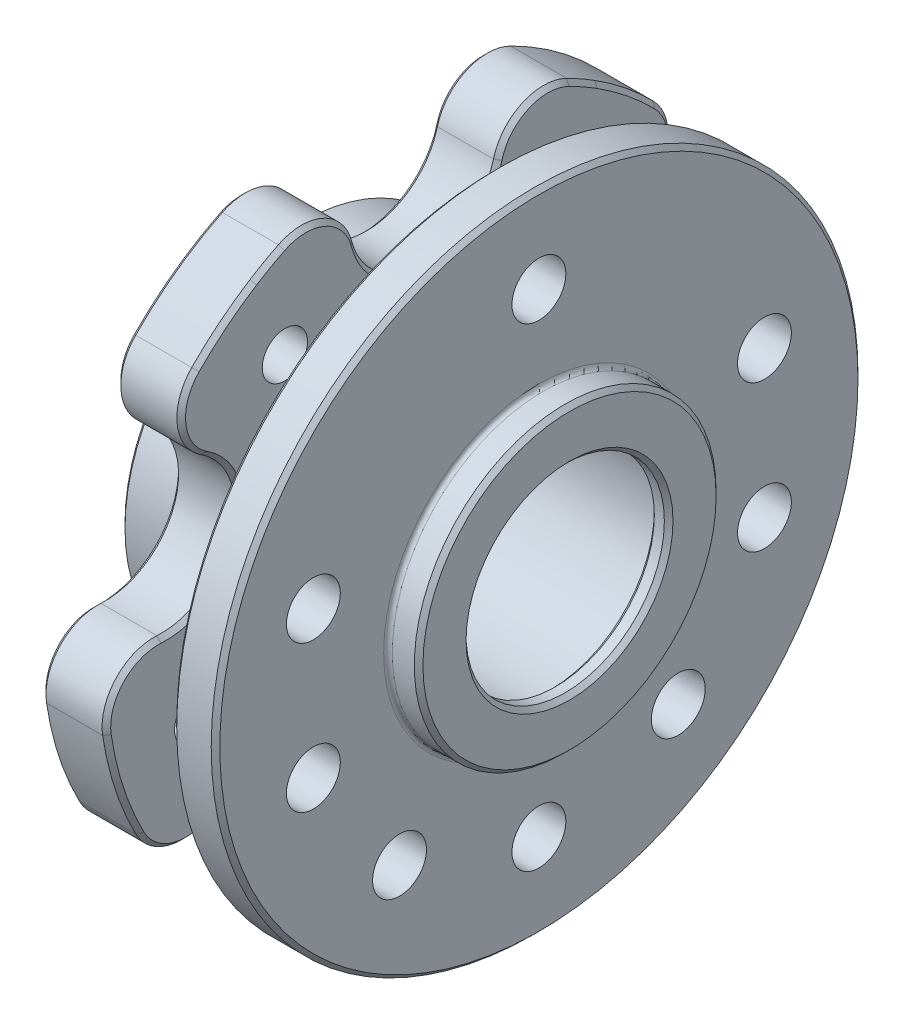
from build123d import *

# Parameters (mm, degrees)
DODANIE_WYCI_GNI_CIE1_START      = -36.1
SZKIC6_R                         = 25
SZKIC6_R_2                       = 15
DODANIE_WYCI_GNI_CIE1_DEPTH      = 36.1
WYTNIJ_WYCI_GNI_CIE4_REACH       = 132.542
SZKIC7_R                         = 15.25
SZKIC7_R_2                       = 15
SZKIC12_R                        = 31
SZKIC12_R_2                      = 15.25
WYTNIJ_WYCI_GNI_CIE9_DEPTH       = 10
WYTNIJ_WYCI_GNI_CIE10_START      = -2
SZKIC13_R                        = 29
SZKIC13_R_2                      = 15.25
WYTNIJ_WYCI_GNI_CIE10_DEPTH      = 2
SZKIC14_R                        = 31
SZKIC14_R_2                      = 26
DODANIE_WYCI_GNI_CIE3_DEPTH      = 52
SZKIC15_R                        = 26
WYTNIJ_WYCI_GNI_CIE11_DEPTH      = 7
SZKIC22_R                        = 27.5
WYTNIJ_WYCI_GNI_CIE18_DEPTH      = 2
SFAZOWANIE1_SIZE                 = 2
SZKIC25_R                        = 75
SZKIC25_R_2                      = 41
WYTNIJ_WYCI_GNI_CIE19_DEPTH      = 5
SZKIC26_R                        = 75
SZKIC26_R_2                      = 41
DODANIE_WYCI_GNI_CIE4_DEPTH      = 5
WYTNIJ_WYCI_GNI_CIE20_START      = -15
WYTNIJ_WYCI_GNI_CIE20_DEPTH      = 15
ZAOKR_GLENIE1_R                  = 12
OTW_R_GWINTOWANY_M12X1_51_REACH  = 124.406
OTW_R_GWINTOWANY_M12X1_51_BORE_R = 5.25
OTW_R_GWINTOWANY_M14X1_51_REACH  = 121.942
OTW_R_GWINTOWANY_M14X1_51_BORE_R = 6.25
ZAOKR_GLENIE2_R                  = 1
SFAZOWANIE2_SIZE                 = 1
SFAZOWANIE3_SIZE                 = 1
DODANIE_WYCI_GNI_CIE5_START      = -2.32
SZKIC34_R                        = 26
SZKIC34_R_2                      = 23
DODANIE_WYCI_GNI_CIE5_DEPTH      = 2.32
SZKIC35_R                        = 35
SZKIC35_R_2                      = 15.25
WYTNIJ_WYCI_GNI_CIE28_DEPTH      = 10
SZKIC37_R                        = 26
WYTNIJ_WYCI_GNI_CIE30_DEPTH      = 4.78
SZKIC38_R                        = 23
WYTNIJ_WYCI_GNI_CIE31_DEPTH      = 2.32
SZKIC39_R                        = 35
WYTNIJ_WYCI_GNI_CIE32_DEPTH      = 5
DODANIE_WYCI_GNI_CIE6_START      = -2.32
SZKIC40_R                        = 26
SZKIC40_R_2                      = 23
DODANIE_WYCI_GNI_CIE6_DEPTH      = 2.32
SZKIC41_R                        = 35
SZKIC41_R_2                      = 23
DODANIE_WYCI_GNI_CIE7_DEPTH      = 2
SFAZOWANIE7_SIZE                 = 1
SFAZOWANIE8_SIZE                 = 1


with BuildPart() as part:
    # Szkic1 → Obrót1 (revolve)
    with BuildSketch(Plane.XY, mode=Mode.PRIVATE) as obr_t1_sk:
        Polygon((-76.1, 31), (-76.1, 41), (-56.1, 41), (-56.1, 75), (-41.1, 75), (-41.1, 41), (-30.1, 41), (-30.1, 75), (-20.1, 75), (-20.1, 35), (0, 35), (0, 25), (-36.1, 25), (-36.1, 31), (-64.1, 31), align=None)
    revolve(obr_t1_sk.sketch.rotate(Axis((-107.268186934, 0, 0), (1, 0, 0)), 90), axis=Axis((-107.268186934, 0, 0), (1, 0, 0)))

    # Szkic6 → Dodanie-wyciągnięcie1 (add)
    with BuildSketch(Plane(origin=(0, 0, 0), x_dir=(0, 0, -1), z_dir=(1, 0, 0)).offset(DODANIE_WYCI_GNI_CIE1_START)):
        Circle(SZKIC6_R)
        Circle(SZKIC6_R_2, mode=Mode.SUBTRACT)
    extrude(amount=DODANIE_WYCI_GNI_CIE1_DEPTH)

    # Szkic7 → Wytnij-wyciągnięcie4 (cut, up to next)
    with BuildSketch(Plane(origin=(0, 0, 0), x_dir=(0, 0, -1), z_dir=(1, 0, 0)), mode=Mode.PRIVATE) as wytnij_wyci_gni_cie4_sk1:
        Circle(SZKIC7_R)
        Circle(SZKIC7_R_2, mode=Mode.SUBTRACT)
    wytnij_wyci_gni_cie4_tool1 = extrude(wytnij_wyci_gni_cie4_sk1.sketch, amount=-WYTNIJ_WYCI_GNI_CIE4_REACH, mode=Mode.PRIVATE) & part.part
    add(wytnij_wyci_gni_cie4_tool1.solids().sort_by_distance((0, 0, 15.206866))[0], mode=Mode.SUBTRACT)

    # Szkic12 → Wytnij-wyciągnięcie9 (cut)
    with BuildSketch(Plane.ZY.offset(36.1)):
        Circle(SZKIC12_R)
        with Locations(Location((0, 0, 0), (0, 0, 180))):
            Circle(SZKIC12_R_2, mode=Mode.SUBTRACT)
    extrude(amount=-WYTNIJ_WYCI_GNI_CIE9_DEPTH, mode=Mode.SUBTRACT)

    # Szkic13 → Wytnij-wyciągnięcie10 (cut)
    with BuildSketch(Plane.ZY.offset(26.1).offset(WYTNIJ_WYCI_GNI_CIE10_START)):
        Circle(SZKIC13_R)
        with Locations(Location((0, 0, 0), (0, 0, 180))):
            Circle(SZKIC13_R_2, mode=Mode.SUBTRACT)
    extrude(amount=WYTNIJ_WYCI_GNI_CIE10_DEPTH, mode=Mode.SUBTRACT)

    # Szkic14 → Dodanie-wyciągnięcie3 (add)
    with BuildSketch(Plane.ZY.offset(76.1)):
        Circle(SZKIC14_R)
        Circle(SZKIC14_R_2, mode=Mode.SUBTRACT)
    extrude(amount=-DODANIE_WYCI_GNI_CIE3_DEPTH)

    # Szkic15 → Wytnij-wyciągnięcie11 (cut)
    with BuildSketch(Plane.ZY.offset(24.1)):
        Circle(SZKIC15_R)
    extrude(amount=-WYTNIJ_WYCI_GNI_CIE11_DEPTH, mode=Mode.SUBTRACT)

    # Szkic22 → Wytnij-wyciągnięcie18 (cut)
    with BuildSketch(Plane.ZY.offset(63.32)):
        Circle(SZKIC22_R)
    extrude(amount=WYTNIJ_WYCI_GNI_CIE18_DEPTH, mode=Mode.SUBTRACT)

    # Sfazowanie1
    sfazowanie1_edges = [part.edges().sort_by_distance(p)[0] for p in [
        (-76.1, 0, -26),
    ]]
    chamfer(sfazowanie1_edges, length=SFAZOWANIE1_SIZE)

    # Szkic25 → Wytnij-wyciągnięcie19 (cut)
    with BuildSketch(Plane(origin=(-41.1, 0, 0), x_dir=(0, 0, -1), z_dir=(1, 0, 0))):
        with Locations(Location((0, 0, 0), (0, 0, 180))):
            Circle(SZKIC25_R)
        with Locations(Location((0, 0, 0), (0, 0, 180))):
            Circle(SZKIC25_R_2, mode=Mode.SUBTRACT)
    extrude(amount=-WYTNIJ_WYCI_GNI_CIE19_DEPTH, mode=Mode.SUBTRACT)

    # Szkic26 → Dodanie-wyciągnięcie4 (add)
    with BuildSketch(Plane.ZY.offset(56.1)):
        Circle(SZKIC26_R)
        Circle(SZKIC26_R_2, mode=Mode.SUBTRACT)
    extrude(amount=DODANIE_WYCI_GNI_CIE4_DEPTH)

    # Szkic27 → Wytnij-wyciągnięcie20 (cut)
    with BuildSketch(Plane.ZY.offset(61.1).offset(WYTNIJ_WYCI_GNI_CIE20_START)):
        with BuildLine():
            ThreePointArc((13.707064455, 73.736804813), (0, 46.681140538), (-13.707064455, 73.736804813))
            ThreePointArc((-13.707064455, 73.736804813), (0, 75), (13.707064455, 73.736804813))
        make_face()
        with BuildLine():
            ThreePointArc((74.363584568, 9.749732829), (44.396402896, 14.425265743), (65.892152848, 35.822118768))
            ThreePointArc((65.892152848, 35.822118768), (71.329238722, 23.176274578), (74.363584568, 9.749732829))
        make_face()
        with BuildLine():
            ThreePointArc((32.252158333, -67.711138544), (27.438485968, -37.765836012), (54.430654508, -51.597517866))
            ThreePointArc((54.430654508, -51.597517866), (44.083893922, -60.676274578), (32.252158333, -67.711138544))
        make_face()
        with BuildLine():
            ThreePointArc((-54.430654508, -51.597517866), (-27.438485968, -37.765836012), (-32.252158333, -67.711138544))
            ThreePointArc((-32.252158333, -67.711138544), (-44.083893922, -60.676274578), (-54.430654508, -51.597517866))
        make_face()
        with BuildLine():
            ThreePointArc((-65.892152848, 35.822118768), (-44.396402896, 14.425265743), (-74.363584568, 9.749732829))
            ThreePointArc((-74.363584568, 9.749732829), (-71.329238722, 23.176274578), (-65.892152848, 35.822118768))
        make_face()
    extrude(amount=WYTNIJ_WYCI_GNI_CIE20_DEPTH, mode=Mode.SUBTRACT)

    # Zaokrąglenie1
    zaokr_glenie1_edges = [part.edges().sort_by_distance(p)[0] for p in [
        (-53.6, 73.736804813, 13.707064455),
        (-53.6, 73.736804813, -13.707064455),
        (-53.6, 9.749732829, 74.363584568),
        (-53.6, 35.822118768, 65.892152848),
        (-53.6, -67.711138544, 32.252158333),
        (-53.6, -51.597517866, 54.430654508),
        (-53.6, -51.597517866, -54.430654508),
        (-53.6, -67.711138544, -32.252158333),
        (-53.6, 35.822118768, -65.892152848),
        (-53.6, 9.749732829, -74.363584568),
    ]]
    fillet(zaokr_glenie1_edges, radius=ZAOKR_GLENIE1_R)

    # Otwór gwintowany M12x1.51 bore → Otwór gwintowany M12x1.51 (cut, up to next)
    with BuildSketch(Plane.ZY.offset(61.1), mode=Mode.PRIVATE) as otw_r_gwintowany_m12x1_51_sk1:
        with Locations((0, -56)):
            Circle(OTW_R_GWINTOWANY_M12X1_51_BORE_R)
    otw_r_gwintowany_m12x1_51_tool1 = extrude(otw_r_gwintowany_m12x1_51_sk1.sketch, amount=-OTW_R_GWINTOWANY_M12X1_51_REACH, mode=Mode.PRIVATE) & part.part
    # Otwór gwintowany M12x1.51 bore → Otwór gwintowany M12x1.51 (cut, up to next)
    with BuildSketch(Plane.ZY.offset(61.1), mode=Mode.PRIVATE) as otw_r_gwintowany_m12x1_51_sk2:
        with Locations((-53.259164913, -17.304951685)):
            Circle(OTW_R_GWINTOWANY_M12X1_51_BORE_R)
    otw_r_gwintowany_m12x1_51_tool2 = extrude(otw_r_gwintowany_m12x1_51_sk2.sketch, amount=-OTW_R_GWINTOWANY_M12X1_51_REACH, mode=Mode.PRIVATE) & part.part
    # Otwór gwintowany M12x1.51 bore → Otwór gwintowany M12x1.51 (cut, up to next)
    with BuildSketch(Plane.ZY.offset(61.1), mode=Mode.PRIVATE) as otw_r_gwintowany_m12x1_51_sk3:
        with Locations((-32.915974128, 45.304951685)):
            Circle(OTW_R_GWINTOWANY_M12X1_51_BORE_R)
    otw_r_gwintowany_m12x1_51_tool3 = extrude(otw_r_gwintowany_m12x1_51_sk3.sketch, amount=-OTW_R_GWINTOWANY_M12X1_51_REACH, mode=Mode.PRIVATE) & part.part
    # Otwór gwintowany M12x1.51 bore → Otwór gwintowany M12x1.51 (cut, up to next)
    with BuildSketch(Plane.ZY.offset(61.1), mode=Mode.PRIVATE) as otw_r_gwintowany_m12x1_51_sk4:
        with Locations((32.915974128, 45.304951685)):
            Circle(OTW_R_GWINTOWANY_M12X1_51_BORE_R)
    otw_r_gwintowany_m12x1_51_tool4 = extrude(otw_r_gwintowany_m12x1_51_sk4.sketch, amount=-OTW_R_GWINTOWANY_M12X1_51_REACH, mode=Mode.PRIVATE) & part.part
    # Otwór gwintowany M12x1.51 bore → Otwór gwintowany M12x1.51 (cut, up to next)
    with BuildSketch(Plane.ZY.offset(61.1), mode=Mode.PRIVATE) as otw_r_gwintowany_m12x1_51_sk5:
        with Locations((53.259164913, -17.304951685)):
            Circle(OTW_R_GWINTOWANY_M12X1_51_BORE_R)
    otw_r_gwintowany_m12x1_51_tool5 = extrude(otw_r_gwintowany_m12x1_51_sk5.sketch, amount=-OTW_R_GWINTOWANY_M12X1_51_REACH, mode=Mode.PRIVATE) & part.part
    add(otw_r_gwintowany_m12x1_51_tool1.solids().sort_by_distance((-61.1, -56, 0))[0], mode=Mode.SUBTRACT)
    add(otw_r_gwintowany_m12x1_51_tool2.solids().sort_by_distance((-61.1, -17.304952, -53.259165))[0], mode=Mode.SUBTRACT)
    add(otw_r_gwintowany_m12x1_51_tool3.solids().sort_by_distance((-61.1, 45.304952, -32.915974))[0], mode=Mode.SUBTRACT)
    add(otw_r_gwintowany_m12x1_51_tool4.solids().sort_by_distance((-61.1, 45.304952, 32.915974))[0], mode=Mode.SUBTRACT)
    add(otw_r_gwintowany_m12x1_51_tool5.solids().sort_by_distance((-61.1, -17.304952, 53.259165))[0], mode=Mode.SUBTRACT)

    # Otwór gwintowany M14x1.51 bore → Otwór gwintowany M14x1.51 (cut, up to next)
    with BuildSketch(Plane(origin=(-20.1, 0, 0), x_dir=(0, 0, -1), z_dir=(1, 0, 0)), mode=Mode.PRIVATE) as otw_r_gwintowany_m14x1_51_sk1:
        with Locations((0, 55)):
            Circle(OTW_R_GWINTOWANY_M14X1_51_BORE_R)
    otw_r_gwintowany_m14x1_51_tool1 = extrude(otw_r_gwintowany_m14x1_51_sk1.sketch, amount=-OTW_R_GWINTOWANY_M14X1_51_REACH, mode=Mode.PRIVATE) & part.part
    # Otwór gwintowany M14x1.51 bore → Otwór gwintowany M14x1.51 (cut, up to next)
    with BuildSketch(Plane(origin=(-20.1, 0, 0), x_dir=(0, 0, -1), z_dir=(1, 0, 0)), mode=Mode.PRIVATE) as otw_r_gwintowany_m14x1_51_sk2:
        with Locations((-52.308108396, 16.995934691)):
            Circle(OTW_R_GWINTOWANY_M14X1_51_BORE_R)
    otw_r_gwintowany_m14x1_51_tool2 = extrude(otw_r_gwintowany_m14x1_51_sk2.sketch, amount=-OTW_R_GWINTOWANY_M14X1_51_REACH, mode=Mode.PRIVATE) & part.part
    # Otwór gwintowany M14x1.51 bore → Otwór gwintowany M14x1.51 (cut, up to next)
    with BuildSketch(Plane(origin=(-20.1, 0, 0), x_dir=(0, 0, -1), z_dir=(1, 0, 0)), mode=Mode.PRIVATE) as otw_r_gwintowany_m14x1_51_sk3:
        with Locations((-52.308108396, -16.995934691)):
            Circle(OTW_R_GWINTOWANY_M14X1_51_BORE_R)
    otw_r_gwintowany_m14x1_51_tool3 = extrude(otw_r_gwintowany_m14x1_51_sk3.sketch, amount=-OTW_R_GWINTOWANY_M14X1_51_REACH, mode=Mode.PRIVATE) & part.part
    # Otwór gwintowany M14x1.51 bore → Otwór gwintowany M14x1.51 (cut, up to next)
    with BuildSketch(Plane(origin=(-20.1, 0, 0), x_dir=(0, 0, -1), z_dir=(1, 0, 0)), mode=Mode.PRIVATE) as otw_r_gwintowany_m14x1_51_sk4:
        with Locations((-32.328188876, -44.495934691)):
            Circle(OTW_R_GWINTOWANY_M14X1_51_BORE_R)
    otw_r_gwintowany_m14x1_51_tool4 = extrude(otw_r_gwintowany_m14x1_51_sk4.sketch, amount=-OTW_R_GWINTOWANY_M14X1_51_REACH, mode=Mode.PRIVATE) & part.part
    # Otwór gwintowany M14x1.51 bore → Otwór gwintowany M14x1.51 (cut, up to next)
    with BuildSketch(Plane(origin=(-20.1, 0, 0), x_dir=(0, 0, -1), z_dir=(1, 0, 0)), mode=Mode.PRIVATE) as otw_r_gwintowany_m14x1_51_sk5:
        with Locations((0, -55)):
            Circle(OTW_R_GWINTOWANY_M14X1_51_BORE_R)
    otw_r_gwintowany_m14x1_51_tool5 = extrude(otw_r_gwintowany_m14x1_51_sk5.sketch, amount=-OTW_R_GWINTOWANY_M14X1_51_REACH, mode=Mode.PRIVATE) & part.part
    # Otwór gwintowany M14x1.51 bore → Otwór gwintowany M14x1.51 (cut, up to next)
    with BuildSketch(Plane(origin=(-20.1, 0, 0), x_dir=(0, 0, -1), z_dir=(1, 0, 0)), mode=Mode.PRIVATE) as otw_r_gwintowany_m14x1_51_sk6:
        with Locations((32.328188876, -44.495934691)):
            Circle(OTW_R_GWINTOWANY_M14X1_51_BORE_R)
    otw_r_gwintowany_m14x1_51_tool6 = extrude(otw_r_gwintowany_m14x1_51_sk6.sketch, amount=-OTW_R_GWINTOWANY_M14X1_51_REACH, mode=Mode.PRIVATE) & part.part
    # Otwór gwintowany M14x1.51 bore → Otwór gwintowany M14x1.51 (cut, up to next)
    with BuildSketch(Plane(origin=(-20.1, 0, 0), x_dir=(0, 0, -1), z_dir=(1, 0, 0)), mode=Mode.PRIVATE) as otw_r_gwintowany_m14x1_51_sk7:
        with Locations((52.308108396, -16.995934691)):
            Circle(OTW_R_GWINTOWANY_M14X1_51_BORE_R)
    otw_r_gwintowany_m14x1_51_tool7 = extrude(otw_r_gwintowany_m14x1_51_sk7.sketch, amount=-OTW_R_GWINTOWANY_M14X1_51_REACH, mode=Mode.PRIVATE) & part.part
    # Otwór gwintowany M14x1.51 bore → Otwór gwintowany M14x1.51 (cut, up to next)
    with BuildSketch(Plane(origin=(-20.1, 0, 0), x_dir=(0, 0, -1), z_dir=(1, 0, 0)), mode=Mode.PRIVATE) as otw_r_gwintowany_m14x1_51_sk8:
        with Locations((52.308108396, 16.995934691)):
            Circle(OTW_R_GWINTOWANY_M14X1_51_BORE_R)
    otw_r_gwintowany_m14x1_51_tool8 = extrude(otw_r_gwintowany_m14x1_51_sk8.sketch, amount=-OTW_R_GWINTOWANY_M14X1_51_REACH, mode=Mode.PRIVATE) & part.part
    add(otw_r_gwintowany_m14x1_51_tool1.solids().sort_by_distance((-20.1, 55, 0))[0], mode=Mode.SUBTRACT)
    add(otw_r_gwintowany_m14x1_51_tool2.solids().sort_by_distance((-20.1, 16.995935, 52.308108))[0], mode=Mode.SUBTRACT)
    add(otw_r_gwintowany_m14x1_51_tool3.solids().sort_by_distance((-20.1, -16.995935, 52.308108))[0], mode=Mode.SUBTRACT)
    add(otw_r_gwintowany_m14x1_51_tool4.solids().sort_by_distance((-20.1, -44.495935, 32.328189))[0], mode=Mode.SUBTRACT)
    add(otw_r_gwintowany_m14x1_51_tool5.solids().sort_by_distance((-20.1, -55, 0))[0], mode=Mode.SUBTRACT)
    add(otw_r_gwintowany_m14x1_51_tool6.solids().sort_by_distance((-20.1, -44.495935, -32.328189))[0], mode=Mode.SUBTRACT)
    add(otw_r_gwintowany_m14x1_51_tool7.solids().sort_by_distance((-20.1, -16.995935, -52.308108))[0], mode=Mode.SUBTRACT)
    add(otw_r_gwintowany_m14x1_51_tool8.solids().sort_by_distance((-20.1, 16.995935, -52.308108))[0], mode=Mode.SUBTRACT)

    # Zaokrąglenie2
    zaokr_glenie2_edges = [part.edges().sort_by_distance(p)[0] for p in [
        (-61.1, 0, -41),
        (-30.1, 0, -41),
        (-20.1, 0, -35),
        (-46.1, 0, -41),
    ]]
    fillet(zaokr_glenie2_edges, radius=ZAOKR_GLENIE2_R)

    # Sfazowanie2
    sfazowanie2_edges = [part.edges().sort_by_distance(p)[0] for p in [
        (-76.1, 0, -41),
        (-30.1, 0, -75),
        (-20.1, 0, -75),
    ]]
    chamfer(sfazowanie2_edges, length=SFAZOWANIE2_SIZE)

    # Sfazowanie3
    sfazowanie3_edges = [part.edges().sort_by_distance(p)[0] for p in [
        (-61.1, -37.765836012, 27.438485968),
        (-46.1, -37.765836012, 27.438485968),
        (-61.1, 46.681140538, 0),
        (-61.1, 60.676274578, -44.083893922),
        (-61.1, 14.425265743, -44.396402896),
        (-61.1, -23.176274578, -71.329238722),
        (-61.1, -37.765836012, -27.438485968),
        (-61.1, -75, 0),
        (-61.1, -23.176274578, 71.329238722),
        (-61.1, 14.425265743, 44.396402896),
        (-61.1, 60.676274578, 44.083893922),
        (-61.1, 67.319978964, -23.094889421),
        (-61.1, 67.319978964, 23.094889421),
        (-61.1, 42.767562637, 56.888391356),
        (-61.1, -1.161527516, 71.161817985),
        (-61.1, -1.161527516, -71.161817985),
        (-61.1, 42.767562637, -56.888391356),
        (-61.1, -68.037842447, -20.885532795),
        (-61.1, -68.037842447, 20.885532795),
        (-61.1, -40.888171638, -58.253848844),
        (-61.1, -40.888171638, 58.253848844),
        (-46.1, -23.176274578, 71.329238722),
        (-46.1, 46.681140538, 0),
        (-46.1, 60.676274578, 44.083893922),
        (-46.1, 14.425265743, 44.396402896),
        (-46.1, -75, 0),
        (-46.1, -37.765836012, -27.438485968),
        (-46.1, -23.176274578, -71.329238722),
        (-46.1, 14.425265743, -44.396402896),
        (-46.1, 60.676274578, -44.083893922),
        (-46.1, 67.319978964, -23.094889421),
        (-46.1, 67.319978964, 23.094889421),
        (-46.1, 42.767562637, 56.888391356),
        (-46.1, -1.161527516, 71.161817985),
        (-46.1, -1.161527516, -71.161817985),
        (-46.1, 42.767562637, -56.888391356),
        (-46.1, -68.037842447, -20.885532795),
        (-46.1, -68.037842447, 20.885532795),
        (-46.1, -40.888171638, -58.253848844),
        (-46.1, -40.888171638, 58.253848844),
        (-46.1, 60.676274578, 44.083893922),
        (-46.1, 60.676274578, -44.083893922),
    ]]
    chamfer(sfazowanie3_edges, length=SFAZOWANIE3_SIZE)

    # Szkic34 → Dodanie-wyciągnięcie5 (add)
    with BuildSketch(Plane(origin=(0, 0, 0), x_dir=(0, 0, -1), z_dir=(1, 0, 0)).offset(DODANIE_WYCI_GNI_CIE5_START)):
        with Locations(Location((0, 0, 0), (0, 0, 180))):
            Circle(SZKIC34_R)
        Circle(SZKIC34_R_2, mode=Mode.SUBTRACT)
    extrude(amount=DODANIE_WYCI_GNI_CIE5_DEPTH)

    # Szkic35 → Wytnij-wyciągnięcie28 (cut)
    with BuildSketch(Plane(origin=(0, 0, 0), x_dir=(0, 0, -1), z_dir=(1, 0, 0))):
        Circle(SZKIC35_R)
        Circle(SZKIC35_R_2, mode=Mode.SUBTRACT)
    extrude(amount=-WYTNIJ_WYCI_GNI_CIE28_DEPTH, mode=Mode.SUBTRACT)

    # Szkic37 → Wytnij-wyciągnięcie30 (cut)
    with BuildSketch(Plane.ZY.offset(17.1)):
        Circle(SZKIC37_R)
    extrude(amount=-WYTNIJ_WYCI_GNI_CIE30_DEPTH, mode=Mode.SUBTRACT)

    # Szkic38 → Wytnij-wyciągnięcie31 (cut)
    with BuildSketch(Plane.ZY.offset(12.32)):
        Circle(SZKIC38_R)
    extrude(amount=-WYTNIJ_WYCI_GNI_CIE31_DEPTH, mode=Mode.SUBTRACT)

    # Szkic39 → Wytnij-wyciągnięcie32 (cut)
    with BuildSketch(Plane(origin=(-10, 0, 0), x_dir=(0, 0, -1), z_dir=(1, 0, 0))):
        Circle(SZKIC39_R)
    extrude(amount=-WYTNIJ_WYCI_GNI_CIE32_DEPTH, mode=Mode.SUBTRACT)

    # Szkic40 → Dodanie-wyciągnięcie6 (add)
    with BuildSketch(Plane(origin=(-15, 0, 0), x_dir=(0, 0, -1), z_dir=(1, 0, 0)).offset(DODANIE_WYCI_GNI_CIE6_START)):
        with Locations(Location((0, 0, 0), (0, 0, 180))):
            Circle(SZKIC40_R)
        Circle(SZKIC40_R_2, mode=Mode.SUBTRACT)
    extrude(amount=DODANIE_WYCI_GNI_CIE6_DEPTH)

    # Szkic41 → Dodanie-wyciągnięcie7 (add)
    with BuildSketch(Plane(origin=(-15, 0, 0), x_dir=(0, 0, -1), z_dir=(1, 0, 0))):
        Circle(SZKIC41_R)
        Circle(SZKIC41_R_2, mode=Mode.SUBTRACT)
    extrude(amount=DODANIE_WYCI_GNI_CIE7_DEPTH)

    # Sfazowanie7
    sfazowanie7_edges = [part.edges().sort_by_distance(p)[0] for p in [
        (-13, 0, 35),
    ]]
    chamfer(sfazowanie7_edges, length=SFAZOWANIE7_SIZE)

    # Sfazowanie8
    sfazowanie8_edges = [part.edges().sort_by_distance(p)[0] for p in [
        (-17.32, 0, 23),
        (-13, 0, 23),
    ]]
    chamfer(sfazowanie8_edges, length=SFAZOWANIE8_SIZE)


solid = part.part
